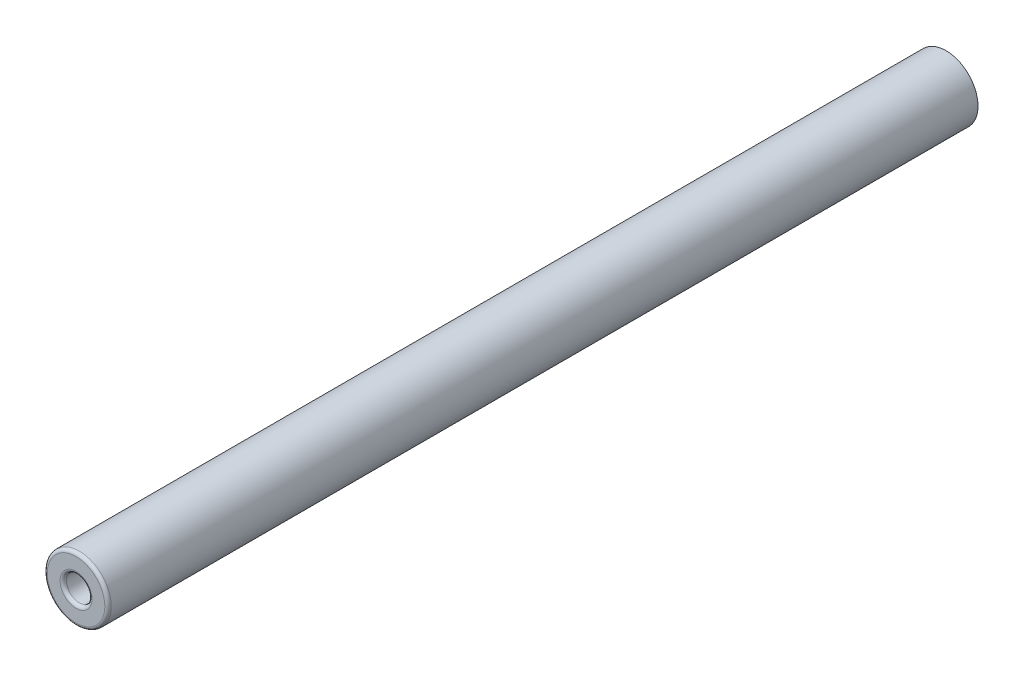
from build123d import *

# Parameters (mm, degrees)
SKETCH1_R           = 2.5
BOSS_EXTRUDE1_DEPTH = 34
SKETCH2_R           = 1
CUT_EXTRUDE1_DEPTH  = 20
FILLET1_R           = 0.25


with BuildPart() as part:
    # Sketch1 → Boss-Extrude1 (new, symmetric)
    with BuildSketch(Plane.XY):
        Circle(SKETCH1_R)
    extrude(amount=BOSS_EXTRUDE1_DEPTH, both=True)

    # Sketch2 → Cut-Extrude1 (cut)
    with BuildSketch(Plane.XY.offset(34)):
        Circle(SKETCH2_R)
    extrude(amount=-CUT_EXTRUDE1_DEPTH, mode=Mode.SUBTRACT)

    # Fillet1
    fillet1_edges = [part.edges().sort_by_distance(p)[0] for p in [
        (-2.5, 0, 34),
        (-1, 0, 34),
    ]]
    fillet(fillet1_edges, radius=FILLET1_R)


solid = part.part
